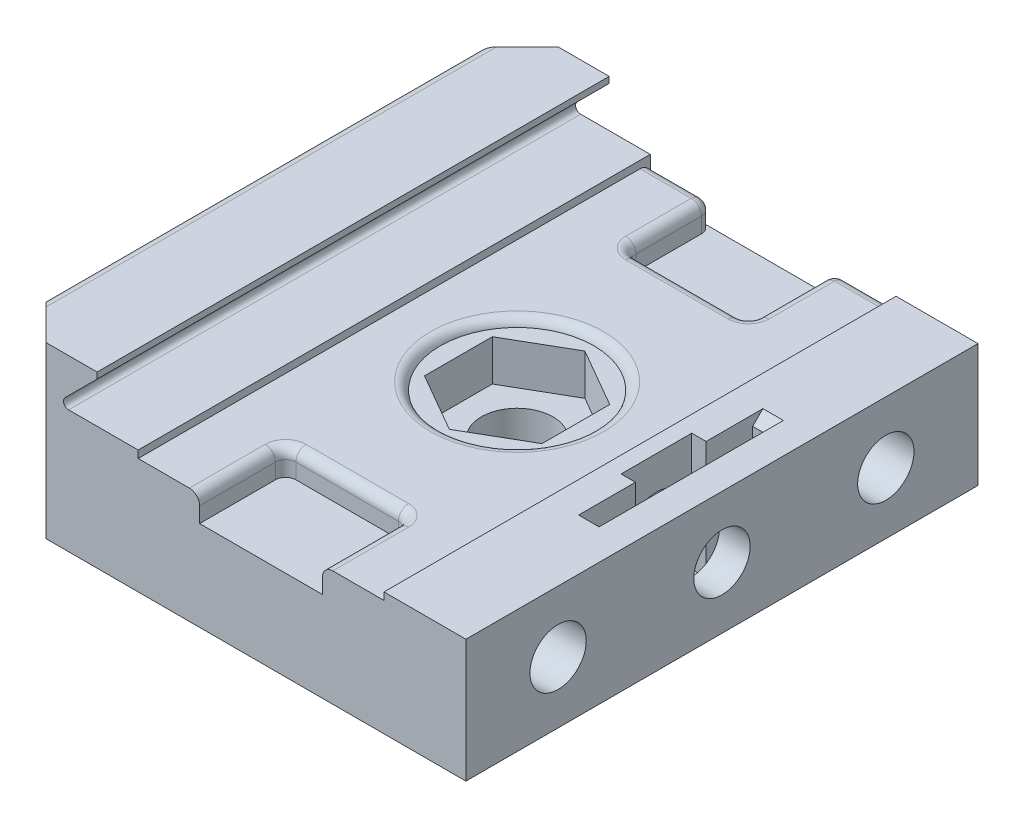
from build123d import *

# Parameters (mm, degrees)
SKETCH1_W            = 45
SKETCH1_H            = 50
BOSS_EXTRUDE1_DEPTH  = 16
CUT_EXTRUDE1_DEPTH   = 58.116109812
SKETCH4_W            = 24
SKETCH4_H            = 50
CUT_EXTRUDE2_DEPTH   = 0.72
CUT_EXTRUDE3_DEPTH   = 58.116109812
SKETCH8_R            = 7.5
CUT_EXTRUDE4_DEPTH   = 0.72
M6_CLEARANCE_HOLE2_D = 7
CUT_EXTRUDE5_DEPTH   = 2.5
FILLET1_R            = 1
FILLET2_R            = 1
FILLET4_R            = 0.5
CUT_EXTRUDE7_DEPTH   = 11.5
SKETCH18_R           = 2.75
CUT_EXTRUDE8_DEPTH   = 14.5
SKETCH19_R           = 2.75
CUT_EXTRUDE9_DEPTH   = 10
SKETCH21_W           = 8.99
SKETCH21_H           = 50
BOSS_EXTRUDE2_DEPTH  = 0.6
CHAMFER1_SIZE        = 4
FILLET5_R            = 1
CUT_EXTRUDE11_DEPTH  = 4
CHAMFER2_SIZE        = 1


with BuildPart() as part:
    # Sketch1 → Boss-Extrude1 (new body)
    with BuildSketch(Plane(origin=(0, 0, 0), x_dir=(1, 0, 0), z_dir=(0, 1, 0))):
        Rectangle(SKETCH1_W, SKETCH1_H)
    extrude(amount=BOSS_EXTRUDE1_DEPTH)

    # Sketch3 → Cut-Extrude1 (cut, through all)
    with BuildSketch(Plane.XY.offset(25)):
        Polygon((-13.5, 16), (-17.5, 12), (22.5, 12), (22.5, 16), align=None)
    extrude(amount=-CUT_EXTRUDE1_DEPTH, mode=Mode.SUBTRACT)

    # Sketch4 → Cut-Extrude2 (cut)
    with BuildSketch(Plane(origin=(0, 12, 0), x_dir=(1, 0, 0), z_dir=(0, 1, 0))):
        with Locations((2.5, 0)):
            Rectangle(SKETCH4_W, SKETCH4_H)
    extrude(amount=-CUT_EXTRUDE2_DEPTH, mode=Mode.SUBTRACT)

    # Sketch5 → Cut-Extrude3 (cut, through all)
    with BuildSketch(Plane.XY.offset(25)):
        Polygon((-22.5, 16), (-13.5, 16), (-13.51, 15.99), (-22.5, 15.99), align=None)
    extrude(amount=-CUT_EXTRUDE3_DEPTH, mode=Mode.SUBTRACT)

    # Sketch8 → Cut-Extrude4 (cut)
    with BuildSketch(Plane(origin=(0, 11.28, 0), x_dir=(1, 0, 0), z_dir=(0, 1, 0))):
        with Locations(Location((2.5, 0, 0), (0, 0, 180))):
            Circle(SKETCH8_R)
    extrude(amount=-CUT_EXTRUDE4_DEPTH, mode=Mode.SUBTRACT)

    # M6 Clearance Hole2 (through all)
    with Locations(Plane(origin=(0, 10.56, 0), x_dir=(1, 0, 0), z_dir=(0, 1, 0))):
        with Locations((2.5, 0)):
            Hole(M6_CLEARANCE_HOLE2_D / 2)

    # Sketch12 → Cut-Extrude5 (cut)
    with BuildSketch(Plane(origin=(0, 11.28, 0), x_dir=(1, 0, 0), z_dir=(0, 1, 0))):
        with BuildLine():
            Line((7.5, 16.6), (-2.5, 16.6))
            ThreePointArc((-2.5, 16.6), (-3.207106781, 16.892893219), (-3.5, 17.6))
            Line((-3.5, 17.6), (-3.5, 25))
            Line((-3.5, 25), (8.5, 25))
            Line((8.5, 25), (8.5, 17.6))
            ThreePointArc((8.5, 17.6), (8.207106781, 16.892893219), (7.5, 16.6))
        make_face()
    cut_extrude5 = extrude(amount=-CUT_EXTRUDE5_DEPTH, mode=Mode.SUBTRACT)

    # Fillet1
    fillet1_edges = [part.edges().sort_by_distance(p)[0] for p in [
        (-3.5, 10.03, -25),
        (8.5, 10.03, -25),
    ]]
    fillet(fillet1_edges, radius=FILLET1_R)

    # Mirror2: Cut-Extrude5 across plane
    add(cut_extrude5.mirror(Plane.XY), mode=Mode.SUBTRACT)

    # Fillet2
    # the kernel refuses this fillet: 1 mm, written as the material it takes off along each edge
    with BuildSketch(Plane(origin=(7.5, 11.28, 17.6), x_dir=(1, 0, 0), z_dir=(0, 0, 1))) as fillet2_piece_1:
        with BuildLine():
            CenterArc((1 + FILLET2_R, -FILLET2_R), FILLET2_R, 90, 90)
            Line((1, -FILLET2_R), (1 - FILLET2_R * 0.02, -FILLET2_R))
            Line((1 - FILLET2_R * 0.02, -FILLET2_R), (1 - FILLET2_R * 0.02, FILLET2_R * 0.02))
            Line((1 - FILLET2_R * 0.02, FILLET2_R * 0.02), (1 + FILLET2_R, FILLET2_R * 0.02))
            Line((1 + FILLET2_R, FILLET2_R * 0.02), (1 + FILLET2_R, 0))
        make_face()
    revolve(axis=Axis((7.5, 11.28, 17.6), (0, 1, 0)), revolution_arc=90, mode=Mode.SUBTRACT)
    with BuildSketch(Plane(origin=(8.5, 11.28, 27.5), x_dir=(1, 0, 0), z_dir=(0, 0, -1)), Plane(origin=(-3.5, 11.28, 17.6), x_dir=(-1, 0, 0), z_dir=(0, 0, 1))) as fillet2_piece_2:
        with BuildLine():
            CenterArc((FILLET2_R, FILLET2_R), FILLET2_R, 180, 90)
            Line((0, FILLET2_R), (-FILLET2_R * 0.02, FILLET2_R))
            Line((-FILLET2_R * 0.02, FILLET2_R), (-FILLET2_R * 0.02, -FILLET2_R * 0.02))
            Line((-FILLET2_R * 0.02, -FILLET2_R * 0.02), (FILLET2_R, -FILLET2_R * 0.02))
            Line((FILLET2_R, -FILLET2_R * 0.02), (FILLET2_R, 0))
        make_face()
    extrude(amount=9.9, mode=Mode.SUBTRACT)
    with BuildSketch(Plane(origin=(-2.5, 11.28, 17.6), x_dir=(0, 0, -1), z_dir=(1, 0, 0))) as fillet2_piece_3:
        with BuildLine():
            CenterArc((1 + FILLET2_R, -FILLET2_R), FILLET2_R, 90, 90)
            Line((1, -FILLET2_R), (1 - FILLET2_R * 0.02, -FILLET2_R))
            Line((1 - FILLET2_R * 0.02, -FILLET2_R), (1 - FILLET2_R * 0.02, FILLET2_R * 0.02))
            Line((1 - FILLET2_R * 0.02, FILLET2_R * 0.02), (1 + FILLET2_R, FILLET2_R * 0.02))
            Line((1 + FILLET2_R, FILLET2_R * 0.02), (1 + FILLET2_R, 0))
        make_face()
    revolve(axis=Axis((-2.5, 11.28, 17.6), (0, 1, 0)), revolution_arc=90, mode=Mode.SUBTRACT)
    with BuildSketch(Plane(origin=(7.5, 11.28, 16.6), x_dir=(0, 0, -1), z_dir=(-1, 0, 0))) as fillet2_piece_4:
        with BuildLine():
            CenterArc((FILLET2_R, FILLET2_R), FILLET2_R, 180, 90)
            Line((0, FILLET2_R), (-FILLET2_R * 0.02, FILLET2_R))
            Line((-FILLET2_R * 0.02, FILLET2_R), (-FILLET2_R * 0.02, -FILLET2_R * 0.02))
            Line((-FILLET2_R * 0.02, -FILLET2_R * 0.02), (FILLET2_R, -FILLET2_R * 0.02))
            Line((FILLET2_R, -FILLET2_R * 0.02), (FILLET2_R, 0))
        make_face()
    extrude(amount=10, mode=Mode.SUBTRACT)
    with BuildSketch(Plane(origin=(-4.5, 11.28, -25), x_dir=(0, 0, 1), z_dir=(-1, 0, 0)), Plane(origin=(14.5, 11.28, -25), x_dir=(0, 0, 1), z_dir=(-1, 0, 0))) as fillet2_piece_5:
        with BuildLine():
            CenterArc((FILLET2_R, -FILLET2_R), FILLET2_R, 90, 90)
            Line((0, -FILLET2_R), (-FILLET2_R * 0.02, -FILLET2_R))
            Line((-FILLET2_R * 0.02, -FILLET2_R), (-FILLET2_R * 0.02, FILLET2_R * 0.02))
            Line((-FILLET2_R * 0.02, FILLET2_R * 0.02), (FILLET2_R, FILLET2_R * 0.02))
            Line((FILLET2_R, FILLET2_R * 0.02), (FILLET2_R, 0))
        make_face()
    extrude(amount=5, mode=Mode.SUBTRACT)
    with BuildSketch(Plane(origin=(2.5, 11.28, 0), x_dir=(-1, 0, 0), z_dir=(0, 0, -1))) as fillet2_piece_6:
        with BuildLine():
            CenterArc((8.46, -1), FILLET2_R, 90, 73.739795292)
            Line((7.5, -0.72), (7.4808, -0.7144))
            ThreePointArc((7.4808, -0.7144), (7.48, -0.36), (7.48, 0))
            Line((7.48, 0), (7.5, 0.02))
            Line((7.5, 0.02), (8.46, 0.02))
            Line((8.46, 0.02), (8.46, 0))
        make_face()
    revolve(axis=Axis((2.5, 11.28, 0), (0, 1, 0)), mode=Mode.SUBTRACT)
    with BuildSketch(Plane(origin=(7.5, 11.28, -17.6), x_dir=(1, 0, 0), z_dir=(0, 0, -1))) as fillet2_piece_7:
        with BuildLine():
            CenterArc((1 + FILLET2_R, FILLET2_R), FILLET2_R, 180, 90)
            Line((1, FILLET2_R), (1 - FILLET2_R * 0.02, FILLET2_R))
            Line((1 - FILLET2_R * 0.02, FILLET2_R), (1 - FILLET2_R * 0.02, -FILLET2_R * 0.02))
            Line((1 - FILLET2_R * 0.02, -FILLET2_R * 0.02), (1 + FILLET2_R, -FILLET2_R * 0.02))
            Line((1 + FILLET2_R, -FILLET2_R * 0.02), (1 + FILLET2_R, 0))
        make_face()
    revolve(axis=Axis((7.5, 11.28, -17.6), (0, -1, 0)), revolution_arc=90, mode=Mode.SUBTRACT)
    with BuildSketch(Plane(origin=(8.5, 11.28, -24), x_dir=(1, 0, 0), z_dir=(0, 0, 1)), Plane(origin=(-3.5, 11.28, -17.6), x_dir=(-1, 0, 0), z_dir=(0, 0, -1))) as fillet2_piece_8:
        with BuildLine():
            CenterArc((FILLET2_R, -FILLET2_R), FILLET2_R, 90, 90)
            Line((0, -FILLET2_R), (-FILLET2_R * 0.02, -FILLET2_R))
            Line((-FILLET2_R * 0.02, -FILLET2_R), (-FILLET2_R * 0.02, FILLET2_R * 0.02))
            Line((-FILLET2_R * 0.02, FILLET2_R * 0.02), (FILLET2_R, FILLET2_R * 0.02))
            Line((FILLET2_R, FILLET2_R * 0.02), (FILLET2_R, 0))
        make_face()
    extrude(amount=6.4, mode=Mode.SUBTRACT)
    with BuildSketch(Plane(origin=(-2.5, 11.28, -17.6), x_dir=(0, 0, 1), z_dir=(1, 0, 0))) as fillet2_piece_9:
        with BuildLine():
            CenterArc((1 + FILLET2_R, FILLET2_R), FILLET2_R, 180, 90)
            Line((1, FILLET2_R), (1 - FILLET2_R * 0.02, FILLET2_R))
            Line((1 - FILLET2_R * 0.02, FILLET2_R), (1 - FILLET2_R * 0.02, -FILLET2_R * 0.02))
            Line((1 - FILLET2_R * 0.02, -FILLET2_R * 0.02), (1 + FILLET2_R, -FILLET2_R * 0.02))
            Line((1 + FILLET2_R, -FILLET2_R * 0.02), (1 + FILLET2_R, 0))
        make_face()
    revolve(axis=Axis((-2.5, 11.28, -17.6), (0, -1, 0)), revolution_arc=90, mode=Mode.SUBTRACT)
    with BuildSketch(Plane(origin=(7.5, 11.28, -16.6), x_dir=(0, 0, 1), z_dir=(-1, 0, 0))) as fillet2_piece_10:
        with BuildLine():
            CenterArc((FILLET2_R, -FILLET2_R), FILLET2_R, 90, 90)
            Line((0, -FILLET2_R), (-FILLET2_R * 0.02, -FILLET2_R))
            Line((-FILLET2_R * 0.02, -FILLET2_R), (-FILLET2_R * 0.02, FILLET2_R * 0.02))
            Line((-FILLET2_R * 0.02, FILLET2_R * 0.02), (FILLET2_R, FILLET2_R * 0.02))
            Line((FILLET2_R, FILLET2_R * 0.02), (FILLET2_R, 0))
        make_face()
    extrude(amount=10, mode=Mode.SUBTRACT)
    with BuildSketch(Plane(origin=(-4.5, 11.28, -24), x_dir=(0, 0, -1), z_dir=(-1, 0, 0))) as fillet2_piece_11:
        with BuildLine():
            CenterArc((1 - FILLET2_R, FILLET2_R), FILLET2_R, 270, 90)
            Line((1, FILLET2_R), (1 + FILLET2_R * 0.02, FILLET2_R))
            Line((1 + FILLET2_R * 0.02, FILLET2_R), (1 + FILLET2_R * 0.02, 0))
            Line((1 + FILLET2_R * 0.02, 0), (1, -FILLET2_R * 0.02))
            Line((1, -FILLET2_R * 0.02), (1 - FILLET2_R, -FILLET2_R * 0.02))
            Line((1 - FILLET2_R, -FILLET2_R * 0.02), (1 - FILLET2_R, 0))
        make_face()
    revolve(axis=Axis((-4.5, 11.28, -24), (0, -1, 0)), revolution_arc=90, mode=Mode.SUBTRACT)
    with BuildSketch(Plane(origin=(9.5, 11.28, -24), x_dir=(0, 0, -1), z_dir=(1, 0, 0))) as fillet2_piece_12:
        with BuildLine():
            CenterArc((1 - FILLET2_R, -FILLET2_R), FILLET2_R, 0, 90)
            Line((1, -FILLET2_R), (1 + FILLET2_R * 0.02, -FILLET2_R))
            Line((1 + FILLET2_R * 0.02, -FILLET2_R), (1 + FILLET2_R * 0.02, 0))
            Line((1 + FILLET2_R * 0.02, 0), (1, FILLET2_R * 0.02))
            Line((1, FILLET2_R * 0.02), (1 - FILLET2_R, FILLET2_R * 0.02))
            Line((1 - FILLET2_R, FILLET2_R * 0.02), (1 - FILLET2_R, 0))
        make_face()
    revolve(axis=Axis((9.5, 11.28, -24), (0, 1, 0)), revolution_arc=90, mode=Mode.SUBTRACT)

    # Fillet4
    fillet4_edges = [part.edges().sort_by_distance(p)[0] for p in [
        (-17.5, 12, 0),
    ]]
    fillet(fillet4_edges, radius=FILLET4_R)

    # Sketch14 → Cut-Extrude7 (cut)
    with BuildSketch(Plane(origin=(0, 12, 0), x_dir=(1, 0, 0), z_dir=(0, 1, 0))):
        Polygon((19.5, -8), (17.5, -8), (17.5, -3.45), (16.1, -3.45), (16.1, 3.45), (17.5, 3.45), (17.5, 8), (19.5, 8), align=None)
    extrude(amount=-CUT_EXTRUDE7_DEPTH, mode=Mode.SUBTRACT)

    # Sketch18 → Cut-Extrude8 (cut)
    with BuildSketch(Plane(origin=(22.5, 0, 0), x_dir=(0, 0, -1), z_dir=(1, 0, 0))):
        with Locations((0, 6)):
            Circle(SKETCH18_R)
    extrude(amount=-CUT_EXTRUDE8_DEPTH, mode=Mode.SUBTRACT)

    # Sketch19 → Cut-Extrude9 (cut)
    with BuildSketch(Plane(origin=(22.5, 0, 0), x_dir=(0, 0, -1), z_dir=(1, 0, 0))):
        with Locations((-16, 6)):
            Circle(SKETCH19_R)
        with Locations((16, 6)):
            Circle(SKETCH19_R)
    extrude(amount=-CUT_EXTRUDE9_DEPTH, mode=Mode.SUBTRACT)

    # Sketch21 → Boss-Extrude2 (add)
    with BuildSketch(Plane(origin=(0, 15.99, 0), x_dir=(1, 0, 0), z_dir=(0, 1, 0))):
        with Locations((-18.005, 0)):
            Rectangle(SKETCH21_W, SKETCH21_H)
    extrude(amount=BOSS_EXTRUDE2_DEPTH)

    # Chamfer1
    chamfer1_edges = [part.edges().sort_by_distance(p)[0] for p in [
        (-22.5, 8.295, 25),
        (-22.5, 8.295, -25),
    ]]
    chamfer(chamfer1_edges, length=CHAMFER1_SIZE)

    # Fillet5
    fillet5_edges = [part.edges().sort_by_distance(p)[0] for p in [
        (-22.5, 16.59, 0),
    ]]
    fillet(fillet5_edges, radius=FILLET5_R)

    # Sketch23 → Cut-Extrude11 (cut)
    with BuildSketch(Plane(origin=(0, 10.56, 0), x_dir=(1, 0, 0), z_dir=(0, 1, 0))):
        Polygon((2.5, 6.618818118), (-3.232064633, 3.309409059), (-3.232064633, -3.309409059), (2.5, -6.618818118), (8.232064633, -3.309409059), (8.232064633, 3.309409059), align=None)
    extrude(amount=-CUT_EXTRUDE11_DEPTH, mode=Mode.SUBTRACT)

    # Chamfer2
    chamfer2_edges = [part.edges().sort_by_distance(p)[0] for p in [
        (18.5, 12, 8),
        (18.5, 12, -8),
    ]]
    chamfer(chamfer2_edges, length=CHAMFER2_SIZE)


solid = part.part
